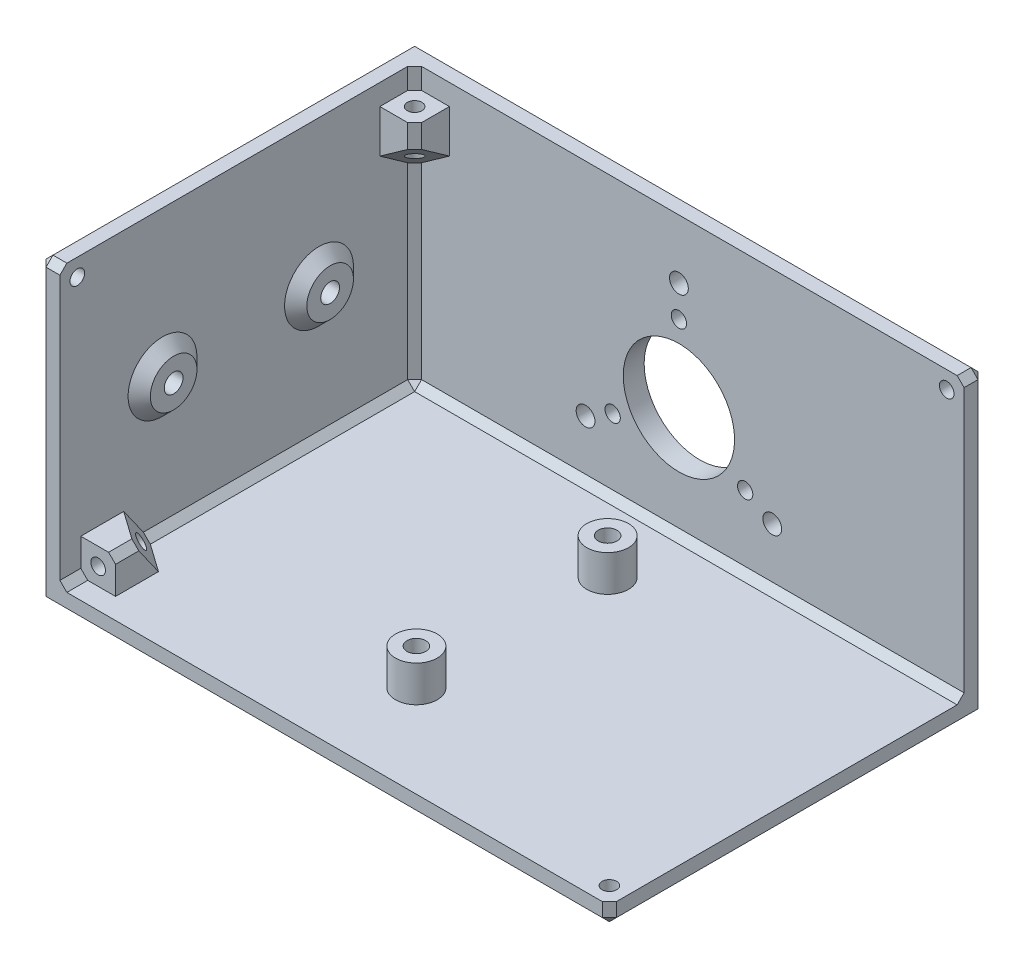
from build123d import *

# Parameters (mm, degrees)
SKETCH_2_W          = 82
SKETCH_2_H          = 54
SKETCH_2_R          = 1.35
SKETCH_2_R_2        = 1.05
EXTRUDE_1_DEPTH     = 3
SKETCH_3_R          = 3
SKETCH_3_R_2        = 1.35
EXTRUDE_2_DEPTH     = 5.2
SKETCH_4_W          = 82
SKETCH_4_H          = 3
EXTRUDE_3_DEPTH     = 40
SKETCH_5_R          = 1.35
SKETCH_5_R_2        = 1.1
SKETCH_5_R_3        = 8
CUT_EXTRUDE_1_DEPTH = 4
SKETCH_6_W          = 54
SKETCH_6_H          = 43
SKETCH_6_R          = 1.35
SKETCH_6_R_2        = 1.05
EXTRUDE_4_DEPTH     = 3
SKETCH_7_R          = 3.35
SKETCH_7_R_2        = 1.35
EXTRUDE_5_DEPTH     = 1.6
SKETCH_8_W          = 8
SKETCH_8_H          = 8
SKETCH_8_R          = 1.05
EXTRUDE_6_DEPTH     = 3
SKETCH_9_W          = 8
SKETCH_9_H          = 8
SKETCH_9_R          = 1.05
EXTRUDE_7_DEPTH     = 3
SKETCH_11_R         = 1.05
CUT_EXTRUDE_2_DEPTH = 5
CHAMFER_1_SIZE      = 1
CHAMFER_2_SIZE      = 6
CHAMFER_3_SIZE      = 1.6


# Some blends are built 0.0001 mm under size
with BuildPart() as part:
    # 草图2 → 凸台-拉伸1 (new body)
    with BuildSketch(Plane(origin=(0, 0, 0), x_dir=(1, 0, 0), z_dir=(0, 1, 0))):
        Rectangle(SKETCH_2_W, SKETCH_2_H)
        with Locations(Location((0, 13.75, 0), (0, 0, 270))):
            Circle(SKETCH_2_R, mode=Mode.SUBTRACT)
        with Locations(Location((0, -13.75, 0), (0, 0, 90))):
            Circle(SKETCH_2_R, mode=Mode.SUBTRACT)
        with Locations(Location((38.5, -24.5, 0), (0, 0, 270))):
            Circle(SKETCH_2_R_2, mode=Mode.SUBTRACT)
    extrude(amount=EXTRUDE_1_DEPTH)

    # 草图3 → 凸台-拉伸2 (add)
    # profile 1 of 2: a face of its own
    with BuildSketch(Plane(origin=(0, 3, 0), x_dir=(1, 0, 0), z_dir=(0, 1, 0))):
        with Locations(Location((0, 13.75, 0), (0, 0, 90))):
            Circle(SKETCH_3_R)
        with Locations(Location((0, 13.75, 0), (0, 0, 270))):
            Circle(SKETCH_3_R_2, mode=Mode.SUBTRACT)
    # profile 2 of 2: a face of its own
    with BuildSketch(Plane(origin=(0, 3, 0), x_dir=(1, 0, 0), z_dir=(0, 1, 0))):
        with Locations(Location((0, -13.75, 0), (0, 0, 90))):
            Circle(SKETCH_3_R)
        with Locations(Location((0, -13.75, 0), (0, 0, 90))):
            Circle(SKETCH_3_R_2, mode=Mode.SUBTRACT)
    extrude(amount=EXTRUDE_2_DEPTH)

    # 草图4 → 凸台-拉伸3 (add)
    with BuildSketch(Plane(origin=(0, 3, 0), x_dir=(1, 0, 0), z_dir=(0, 1, 0))):
        with Locations((0, 25.5)):
            Rectangle(SKETCH_4_W, SKETCH_4_H)
    extrude(amount=EXTRUDE_3_DEPTH)

    # 草图5 → 切除-拉伸1 (cut)
    with BuildSketch(Plane(origin=(0, 0, -27), x_dir=(-1, 0, 0), z_dir=(0, 0, -1))):
        with Locations((-13.423393759, 11.25)):
            Circle(SKETCH_5_R)
        with Locations((-9.526279442, 13.5)):
            Circle(SKETCH_5_R_2)
        with Locations((13.423393759, 11.25)):
            Circle(SKETCH_5_R)
        with Locations((9.526279442, 13.5)):
            Circle(SKETCH_5_R_2)
        with Locations((0, 30)):
            Circle(SKETCH_5_R_2)
        with Locations((0, 34.5)):
            Circle(SKETCH_5_R)
        with Locations((0, 19)):
            Circle(SKETCH_5_R_3)
    extrude(amount=-CUT_EXTRUDE_1_DEPTH, mode=Mode.SUBTRACT)

    # 草图6 → 凸台-拉伸4 (add)
    with BuildSketch(Plane.ZY.offset(41)):
        with Locations((0, 21.5)):
            Rectangle(SKETCH_6_W, SKETCH_6_H)
        with Locations((-10.25, 22)):
            Circle(SKETCH_6_R, mode=Mode.SUBTRACT)
        with Locations(Location((12.25, 22, 0), (0, 0, 180))):
            Circle(SKETCH_6_R, mode=Mode.SUBTRACT)
        with Locations((24.5, 40.5)):
            Circle(SKETCH_6_R_2, mode=Mode.SUBTRACT)
    extrude(amount=-EXTRUDE_4_DEPTH)

    # 草图7 → 凸台-拉伸5 (add)
    # profile 1 of 2: a face of its own
    with BuildSketch(Plane(origin=(-38, 0, 0), x_dir=(0, 0, -1), z_dir=(1, 0, 0))):
        with Locations(Location((-12.25, 22, 0), (0, 0, 180))):
            Circle(SKETCH_7_R)
        with Locations((-12.25, 22)):
            Circle(SKETCH_7_R_2, mode=Mode.SUBTRACT)
    # profile 2 of 2: a face of its own
    with BuildSketch(Plane(origin=(-38, 0, 0), x_dir=(0, 0, -1), z_dir=(1, 0, 0))):
        with Locations(Location((10.25, 22, 0), (0, 0, 180))):
            Circle(SKETCH_7_R)
        with Locations(Location((10.25, 22, 0), (0, 0, 180))):
            Circle(SKETCH_7_R_2, mode=Mode.SUBTRACT)
    extrude(amount=EXTRUDE_5_DEPTH)

    # 草图8 → 凸台-拉伸6 (add)
    with BuildSketch(Plane(origin=(0, 40, 0), x_dir=(1, 0, 0), z_dir=(0, 1, 0))):
        with Locations((-37, 23)):
            Rectangle(SKETCH_8_W, SKETCH_8_H)
        with Locations(Location((-35.5, 21.5, 0), (0, 0, 270))):
            Circle(SKETCH_8_R, mode=Mode.SUBTRACT)
    extrude(amount=-EXTRUDE_6_DEPTH)

    # 草图9 → 凸台-拉伸7 (add)
    with BuildSketch(Plane.XY.offset(24)):
        with Locations((-37, 4)):
            Rectangle(SKETCH_9_W, SKETCH_9_H)
        with Locations((-35.5, 5.5)):
            Circle(SKETCH_9_R, mode=Mode.SUBTRACT)
    extrude(amount=-EXTRUDE_7_DEPTH)

    # 草图11 → 切除-拉伸2 (cut)
    with BuildSketch(Plane(origin=(0, 0, -27), x_dir=(-1, 0, 0), z_dir=(0, 0, -1))):
        with Locations((-38.5, 40.5)):
            Circle(SKETCH_11_R)
    extrude(amount=-CUT_EXTRUDE_2_DEPTH, mode=Mode.SUBTRACT)

    # 倒角1
    chamfer_1_edges = [part.edges().sort_by_distance(p)[0] for p in [
        (-38, 41.5, -24),
        (-33, 38.5, -19),
        (-38, 3, -1.5),
        (-33, 8, 22.5),
        (-41, 43, 0),
        (41, 43, -25.5),
        (0, 43, -27),
        (0, 0, 27),
        (-41, 0, 0),
        (0, 0, -27),
        (41, 0, 0),
        (41, 1.5, 27),
        (-41, 21.5, 27),
        (-41, 21.5, -27),
        (41, 21.5, -27),
        (1.5, 3, -24),
        (-39.5, 43, 27),
        (-38, 3, 25.5),
        (-38, 20, -24),
    ]]
    chamfer(chamfer_1_edges, length=CHAMFER_1_SIZE)

    # 倒角2
    # the kernel refuses this chamfer: 6 mm, written as the material it adds along each edge
    with BuildSketch(Plane(origin=(-48.910726879, 37, -12.089273121), x_dir=(0.7068394360706733, 0.027495876610586785, 0.7068394360706736), z_dir=(0.7071067811865476, 0, -0.7071067811865476))) as chamfer_2_piece_1_section:
        Polygon((CHAMFER_2_SIZE * 0.999621916911, CHAMFER_2_SIZE * 0.0274958766106), (-CHAMFER_2_SIZE * 0.0274958766106, CHAMFER_2_SIZE * 0.999621916911), (0, 0), align=None)
    chamfer_2_piece_1 = extrude(amount=32.274409418, mode=Mode.PRIVATE)
    chamfer_2_piece_1 = split(chamfer_2_piece_1, bisect_by=Plane(origin=(-34.186783964, 35.742495362, -19), z_dir=(0, 0, -1)), keep=Keep.TOP, mode=Mode.PRIVATE)
    chamfer_2_piece_1 = split(chamfer_2_piece_1, bisect_by=Plane(origin=(-41, 35.742495362, -20.186783964), z_dir=(1, 0, 0)), keep=Keep.TOP, mode=Mode.PRIVATE)
    chamfer_2_piece_1 = split(chamfer_2_piece_1, bisect_by=Plane(origin=(-33, 35.742495362, -20.186783964), z_dir=(-1, 0, 0)), keep=Keep.TOP, mode=Mode.PRIVATE)
    chamfer_2_piece_1 = split(chamfer_2_piece_1, bisect_by=Plane(origin=(-33.5, 35.742495362, -19.5), z_dir=(-0.7071067811865476, 0, -0.7071067811865476)), keep=Keep.TOP, mode=Mode.PRIVATE)
    chamfer_2_piece_1 = chamfer_2_piece_1 - Plane(origin=(-35.5, 35.742495362, -21.5), x_dir=(0, 0, 1), z_dir=(0, 1, 0)) * Cylinder(1.05, 89, mode=Mode.PRIVATE)
    chamfer_2_piece_1 = split(chamfer_2_piece_1, bisect_by=Plane(origin=(-34.186783964, 35.742495362, -27), z_dir=(0, 0, 1)), keep=Keep.TOP, mode=Mode.PRIVATE)
    add(chamfer_2_piece_1)
    with BuildSketch(Plane(origin=(-48.910726879, 14.910726879, 21), x_dir=(0.7068394360706735, 0.7068394360706735, 0.027495876610586212), z_dir=(0.7071067811865476, -0.7071067811865476, 0))) as chamfer_2_piece_2_section:
        Polygon((CHAMFER_2_SIZE * 0.999621916911, -CHAMFER_2_SIZE * 0.0274958766106), (-CHAMFER_2_SIZE * 0.0274958766106, -CHAMFER_2_SIZE * 0.999621916911), (0, 0), align=None)
    chamfer_2_piece_2 = extrude(amount=32.274409418, mode=Mode.PRIVATE)
    chamfer_2_piece_2 = split(chamfer_2_piece_2, bisect_by=Plane(origin=(-34.186783964, 8, 19.742495362), z_dir=(0, -1, 0)), keep=Keep.TOP, mode=Mode.PRIVATE)
    chamfer_2_piece_2 = split(chamfer_2_piece_2, bisect_by=Plane(origin=(-41, 6.813216036, 19.742495362), z_dir=(1, 0, 0)), keep=Keep.TOP, mode=Mode.PRIVATE)
    chamfer_2_piece_2 = split(chamfer_2_piece_2, bisect_by=Plane(origin=(-33, 6.813216036, 19.742495362), z_dir=(-1, 0, 0)), keep=Keep.TOP, mode=Mode.PRIVATE)
    chamfer_2_piece_2 = split(chamfer_2_piece_2, bisect_by=Plane(origin=(-34.186783964, 0, 19.742495362), z_dir=(0, 1, 0)), keep=Keep.TOP, mode=Mode.PRIVATE)
    chamfer_2_piece_2 = split(chamfer_2_piece_2, bisect_by=Plane(origin=(-33.5, 7.5, 19.742495362), z_dir=(-0.7071067811865438, -0.7071067811865512, 0)), keep=Keep.TOP, mode=Mode.PRIVATE)
    chamfer_2_piece_2 = chamfer_2_piece_2 - Plane(origin=(-35.5, 5.5, 19.742495362), x_dir=(1, 0, 0), z_dir=(0, 0, 1)) * Cylinder(1.05, 89, mode=Mode.PRIVATE)
    add(chamfer_2_piece_2)

    # 倒角3
    chamfer_3_edges = [part.edges().sort_by_distance(p)[0] for p in [
        (-38, 22, 8.9),
        (-38, 22, -13.6),
    ]]
    chamfer(chamfer_3_edges, length=CHAMFER_3_SIZE - 0.0001)  # a hair under: the kernel refuses the full size


solid = part.part
